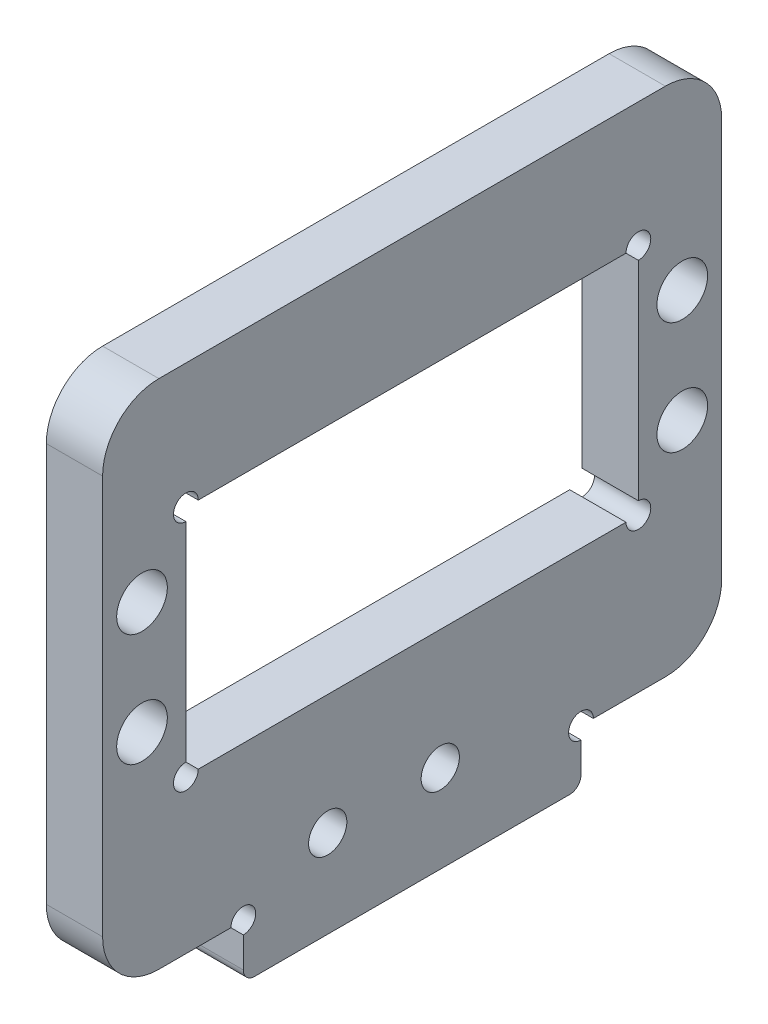
from build123d import *

# Parameters (mm, degrees)
SKETCH_1_W                   = 55
SKETCH_1_H                   = 45.45
SKETCH_1_W_2                 = 40.2
SKETCH_1_H_2                 = 20.7
EXTRUDE_1_DEPTH              = 5
SKETCH_2_W                   = 30
SKETCH_2_H                   = 4.8
EXTRUDE_2_DEPTH              = 5
FILLET_1_R                   = 5
SKETCH_3_R                   = 1.1
CUT_EXTRUDE_1_DEPTH          = 5
FILLET_2_R                   = 1
HOLE_WIZARD_M3_1_D           = 3.4
M4_CLEARANCE_HOLE1_OUTLINE_R = 2.25
M4_CLEARANCE_HOLE1_DEPTH     = 5


# Read off the part's stored shape, not the designer's step: M4 Clearance Hole1
with BuildPart() as part:
    # 草图1 → 凸台-拉伸1 (new body)
    with BuildSketch(Plane(origin=(0, 0, 0), x_dir=(0, 0, -1), z_dir=(1, 0, 0))):
        with Locations((27.5, 22.725)):
            Rectangle(SKETCH_1_W, SKETCH_1_H)
        with Locations((27.5, 24)):
            Rectangle(SKETCH_1_W_2, SKETCH_1_H_2, mode=Mode.SUBTRACT)
    extrude(amount=EXTRUDE_1_DEPTH)

    # 草图2 → 凸台-拉伸2 (add)
    with BuildSketch(Plane(origin=(5, 0, 0), x_dir=(0, 0, -1), z_dir=(1, 0, 0))):
        with Locations((27.5, -2.4)):
            Rectangle(SKETCH_2_W, SKETCH_2_H)
    extrude(amount=-EXTRUDE_2_DEPTH)

    # 圆角1
    fillet_1_edges = [part.edges().sort_by_distance(p)[0] for p in [
        (2.5, 45.45, 0),
        (2.5, 45.45, -55),
        (2.5, 0, -55),
        (2.5, 0, 0),
    ]]
    fillet(fillet_1_edges, radius=FILLET_1_R)

    # 草图3 → 切除-拉伸1 (cut)
    with BuildSketch(Plane(origin=(5, 0, 0), x_dir=(0, 0, -1), z_dir=(1, 0, 0))):
        with Locations((12.5, 0)):
            Circle(SKETCH_3_R)
        with Locations((42.5, 0)):
            Circle(SKETCH_3_R)
        with Locations((7.4, 13.65)):
            Circle(SKETCH_3_R)
        with Locations((7.4, 34.35)):
            Circle(SKETCH_3_R)
        with Locations((47.6, 34.35)):
            Circle(SKETCH_3_R)
        with Locations((47.6, 13.65)):
            Circle(SKETCH_3_R)
    extrude(amount=-CUT_EXTRUDE_1_DEPTH, mode=Mode.SUBTRACT)

    # 圆角2
    fillet_2_edges = [part.edges().sort_by_distance(p)[0] for p in [
        (2.5, -4.8, -42.5),
        (2.5, -4.8, -12.5),
    ]]
    fillet(fillet_2_edges, radius=FILLET_2_R)

    # M3 间隙孔1 (through all)
    with Locations(Plane.ZY):
        with Locations((-20, 3), (-30, 3)):
            Hole(HOLE_WIZARD_M3_1_D / 2)

    # M4 Clearance Hole1 outline → M4 Clearance Hole1 (cut)
    with BuildSketch(Plane.YZ):
        with Locations((29, -3.5)):
            Circle(M4_CLEARANCE_HOLE1_OUTLINE_R)
        with Locations((19, -51.5)):
            Circle(M4_CLEARANCE_HOLE1_OUTLINE_R)
        with Locations((19, -3.5)):
            Circle(M4_CLEARANCE_HOLE1_OUTLINE_R)
        with Locations((29, -51.5)):
            Circle(M4_CLEARANCE_HOLE1_OUTLINE_R)
    extrude(amount=M4_CLEARANCE_HOLE1_DEPTH, mode=Mode.SUBTRACT)


solid = part.part
